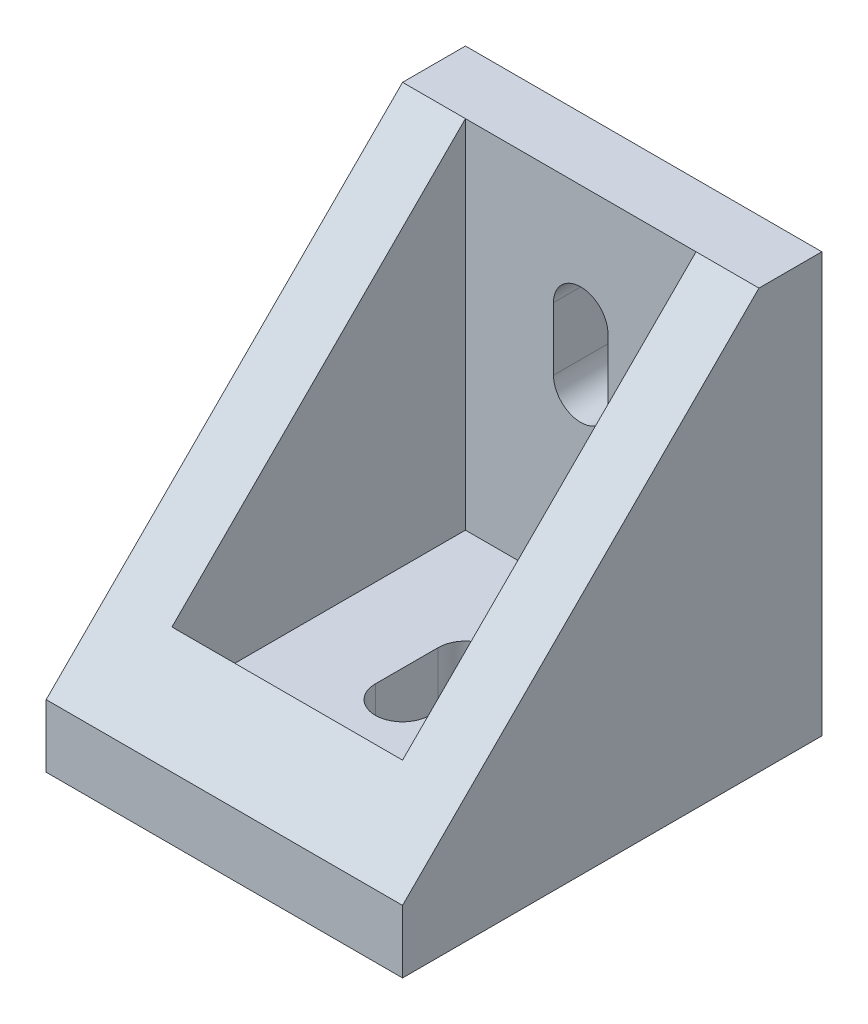
from build123d import *

# Parameters (mm, degrees)
SKETCH1_W           = 17
SKETCH1_H           = 20
BOSS_EXTRUDE1_DEPTH = 20
SHELL1_T            = -3
CUT_EXTRUDE1_DEPTH  = 29.08914381
CUT_EXTRUDE2_DEPTH  = 22.476731595
CUT_EXTRUDE3_DEPTH  = 28.590759323


with BuildPart() as part:
    # Sketch1 → Boss-Extrude1 (new body)
    with BuildSketch(Plane(origin=(0, 0, 0), x_dir=(1, 0, 0), z_dir=(0, 1, 0))):
        Rectangle(SKETCH1_W, SKETCH1_H)
    extrude(amount=BOSS_EXTRUDE1_DEPTH)

    # Shell1
    shell1_openings = [part.faces().sort_by_distance(p)[0] for p in [
        (0, 20, 0),
    ]]
    offset(amount=SHELL1_T, openings=shell1_openings, kind=Kind.INTERSECTION)

    # Sketch3 → Cut-Extrude1 (cut, through all)
    with BuildSketch(Plane(origin=(8.5, 0, 0), x_dir=(0, 0, -1), z_dir=(1, 0, 0))):
        Polygon((7, 20), (-10, 20), (-10, 3), align=None)
    extrude(amount=-CUT_EXTRUDE1_DEPTH, mode=Mode.SUBTRACT)

    # Sketch4 → Cut-Extrude2 (cut, through all)
    with BuildSketch(Plane(origin=(0, 3, 0), x_dir=(1, 0, 0), z_dir=(0, 1, 0))):
        with BuildLine():
            Line((1.3, 1.5), (1.3, -1.5))
            ThreePointArc((1.3, -1.5), (0, -2.8), (-1.3, -1.5))
            Line((-1.3, -1.5), (-1.3, 1.5))
            ThreePointArc((-1.3, 1.5), (0, 2.8), (1.3, 1.5))
        make_face()
    extrude(amount=-CUT_EXTRUDE2_DEPTH, mode=Mode.SUBTRACT)

    # Sketch5 → Cut-Extrude3 (cut, through all)
    with BuildSketch(Plane.XY.offset(-7)):
        with BuildLine():
            Line((1.3, 14.5), (1.3, 11.5))
            ThreePointArc((1.3, 11.5), (0, 10.2), (-1.3, 11.5))
            Line((-1.3, 11.5), (-1.3, 14.5))
            ThreePointArc((-1.3, 14.5), (0, 15.8), (1.3, 14.5))
        make_face()
    extrude(amount=-CUT_EXTRUDE3_DEPTH, mode=Mode.SUBTRACT)


solid = part.part
